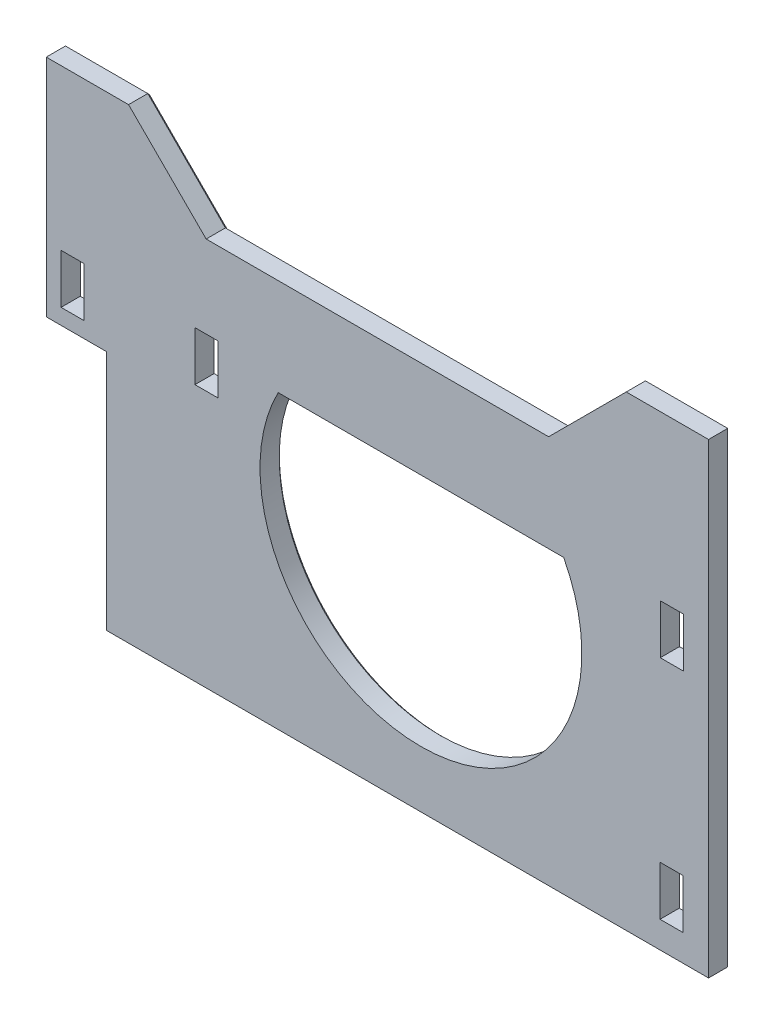
from build123d import *

# Parameters (mm, degrees)
SKETCH1_W           = 4.2
SKETCH1_H           = 9
BOSS_EXTRUDE1_DEPTH = 4
BOSS_EXTRUDE2_DEPTH = 4
CHAMFER1_SIZE       = 0.5


with BuildPart() as part:
    # Sketch1 → Boss-Extrude1 (new body)
    with BuildSketch(Plane.XY):
        Polygon((52.534375, 30), (52.534375, -30), (-57.165625, -30), (-57.165625, 14), (-68.165625, 14), (-68.165625, 30), align=None)
        with BuildLine():
            Line((-25.900000003, 23.179137901), (26.135555553, 23.179137901))
            ThreePointArc((26.135555553, 23.179137901), (0.117777775, -19.676914391), (-25.900000003, 23.179137901))
        make_face(mode=Mode.SUBTRACT)
        with Locations((-38.965625, 21.35)):
            Rectangle(SKETCH1_W, SKETCH1_H, mode=Mode.SUBTRACT)
        with Locations((45.834375, 20.65)):
            Rectangle(SKETCH1_W, SKETCH1_H, mode=Mode.SUBTRACT)
        with Locations((45.8, -20.65)):
            Rectangle(SKETCH1_W, SKETCH1_H, mode=Mode.SUBTRACT)
        with Locations((-63.365625, 21.35)):
            Rectangle(SKETCH1_W, SKETCH1_H, mode=Mode.SUBTRACT)
    extrude(amount=BOSS_EXTRUDE1_DEPTH)

    # Sketch2 → Boss-Extrude2 (add)
    with BuildSketch(Plane.XY):
        Polygon((-68.165625, 30), (52.534375, 30), (52.534375, 55), (37.534375, 55), (23.392239376, 40.857864376), (-39.023489376, 40.857864376), (-53.165625, 55), (-68.165625, 55), align=None)
    extrude(amount=BOSS_EXTRUDE2_DEPTH)

    # Chamfer1
    chamfer1_edges = [part.edges().sort_by_distance(p)[0] for p in [
        (45.8, -25.15, 0),
        (43.7, -20.65, 0),
        (45.8, -16.15, 0),
        (47.9, -20.65, 0),
        (-63.365625, 25.85, 0),
        (-61.265625, 21.35, 0),
        (-63.365625, 16.85, 0),
        (-65.465625, 21.35, 0),
        (0.117777775, 23.179137901, 0),
        (0.117777775, -19.676914391, 0),
        (-62.665625, 14, 0),
        (-57.165625, -8, 0),
        (-2.315625, -30, 0),
        (52.534375, 12.5, 0),
        (45.034375, 55, 0),
        (30.463307188, 47.928932188, 0),
        (-7.815625, 40.857864376, 0),
        (-46.094557188, 47.928932188, 0),
        (-60.665625, 55, 0),
        (-68.165625, 34.5, 0),
        (-38.965625, 25.85, 0),
        (-36.865625, 21.35, 0),
        (-38.965625, 16.85, 0),
        (-41.065625, 21.35, 0),
        (45.834375, 25.15, 0),
        (47.934375, 20.65, 0),
        (45.834375, 16.15, 0),
        (43.734375, 20.65, 0),
    ]]
    chamfer(chamfer1_edges, length=CHAMFER1_SIZE)


solid = part.part
